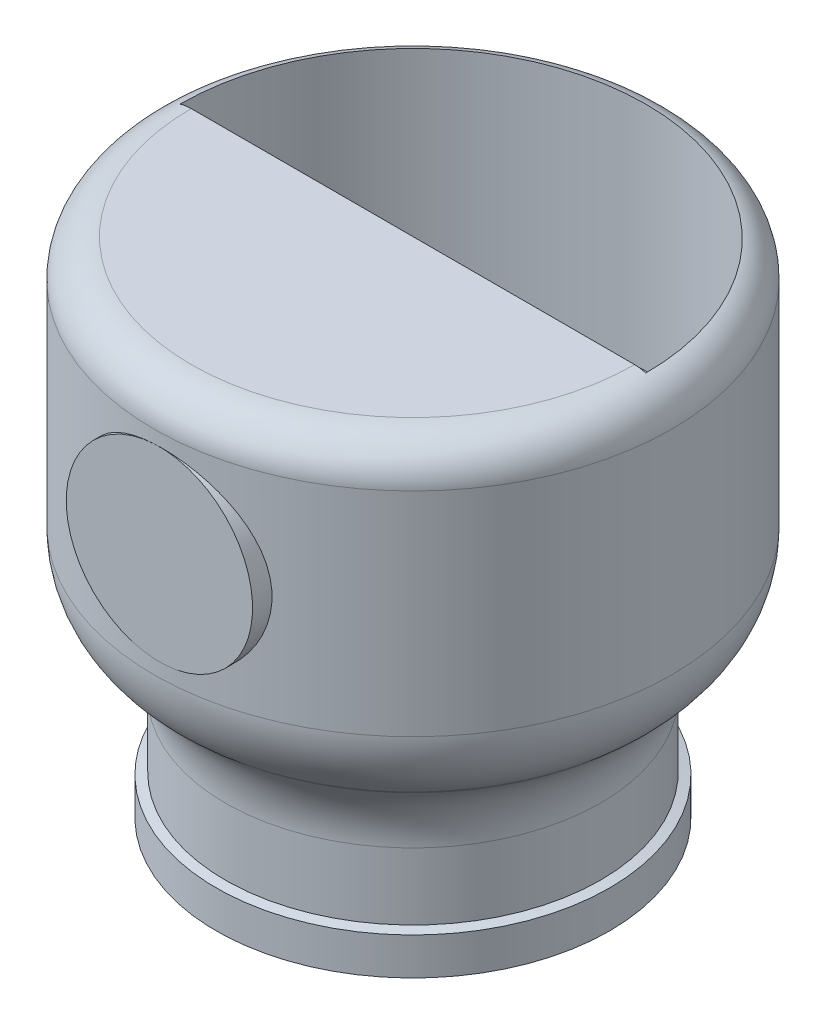
from build123d import *
from build123d.topology import SkipClean

# Parameters (mm, degrees)
CUT_EXTRUDE2_DEPTH      = 25
SKETCH10_R              = 10
BOSS_EXTRUDE1_DEPTH     = 5
CUT_EXTRUDE3_DEPTH      = 15
CUT_EXTRUDE3_DEPTH_BACK = 10


with BuildPart() as part:
    # Sketch1 → Revolve1 (revolve)
    with BuildSketch(Plane.XY):
        with BuildLine():
            Line((20.9, 0), (23.871591838, 0))
            Line((23.871591838, 0), (23.871591838, 4))
            Line((23.871591838, 4), (22.9, 4.236662843))
            Line((22.9, 4.236662843), (22.9, 11.404308102))
            ThreePointArc((22.9, 11.404308102), (23.83692213, 15.63049072), (26.472123903, 19.064752533))
            Line((26.472123903, 19.064752533), (26.988320528, 19.497892931))
            ThreePointArc((26.988320528, 19.497892931), (29.623522302, 22.932154745), (30.560444431, 27.158337362))
            Line((30.560444431, 27.158337362), (30.560444431, 50))
            ThreePointArc((30.560444431, 50), (29.388871556, 52.828427125), (26.560444431, 54))
            Line((26.560444431, 54), (2.764914955, 54))
            Line((2.764914955, 54), (2.764914955, 15))
            Line((2.764914955, 15), (19.9, 15))
            ThreePointArc((19.9, 15), (20.607106781, 14.707106781), (20.9, 14))
            Line((20.9, 14), (20.9, 0))
        make_face()
    revolve(axis=Axis((2.764914955, 7.821821657, 0), (0, 1, 0)))

    # Sketch9 → Cut-Extrude2 (cut)
    with BuildSketch(Plane(origin=(0, 54, 0), x_dir=(1, 0, 0), z_dir=(0, 1, 0))):
        with BuildLine():
            Line((-22.235085045, 0), (27.764914955, 0))
            ThreePointArc((27.764914955, 0), (2.764914955, 25), (-22.235085045, 0))
        make_face()
    extrude(amount=-CUT_EXTRUDE2_DEPTH, mode=Mode.SUBTRACT)

    # Sketch10 → Boss-Extrude1 (add)
    with SkipClean():  # the faces are left unmerged after this step: merging them gives an invalid solid
        with BuildSketch(Plane.XY.offset(27.795529476)):
            with Locations((3.346345887, 38.658337362)):
                Circle(SKETCH10_R)
        extrude(amount=-BOSS_EXTRUDE1_DEPTH)

    # Sketch11 → Cut-Extrude3 (cut, two sides: drawn at the far end of the back side and taken through both)
    with SkipClean():  # the faces are left unmerged after this step: merging them gives an invalid solid
        with BuildSketch(Plane(origin=(0, 17, 0), x_dir=(1, 0, 0), z_dir=(0, 1, 0)).offset(-CUT_EXTRUDE3_DEPTH_BACK)):
            with BuildLine():
                Line((-14.735085045, 0), (20.264914955, 0))
                ThreePointArc((20.264914955, 0), (2.764914955, 17.5), (-14.735085045, 0))
            make_face()
        extrude(amount=CUT_EXTRUDE3_DEPTH + CUT_EXTRUDE3_DEPTH_BACK, mode=Mode.SUBTRACT)


solid = part.part
